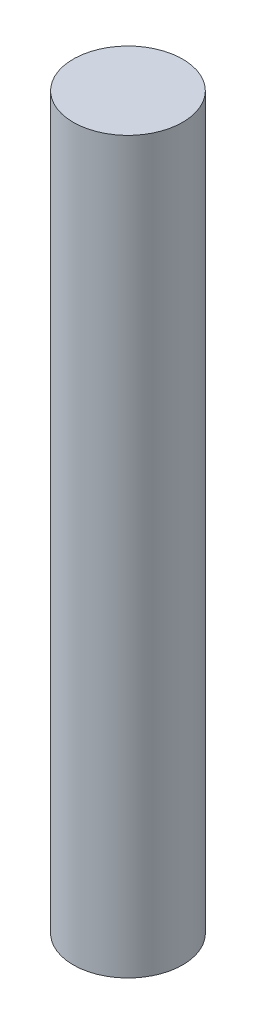
from build123d import *

# Parameters (mm, degrees)
SKETCH1_R           = 3
BOSS_EXTRUDE1_DEPTH = 40


with BuildPart() as part:
    # Sketch1 → Boss-Extrude1 (new body)
    with BuildSketch(Plane(origin=(0, 0, 0), x_dir=(1, 0, 0), z_dir=(0, 1, 0))):
        Circle(SKETCH1_R)
    extrude(amount=BOSS_EXTRUDE1_DEPTH)


solid = part.part
